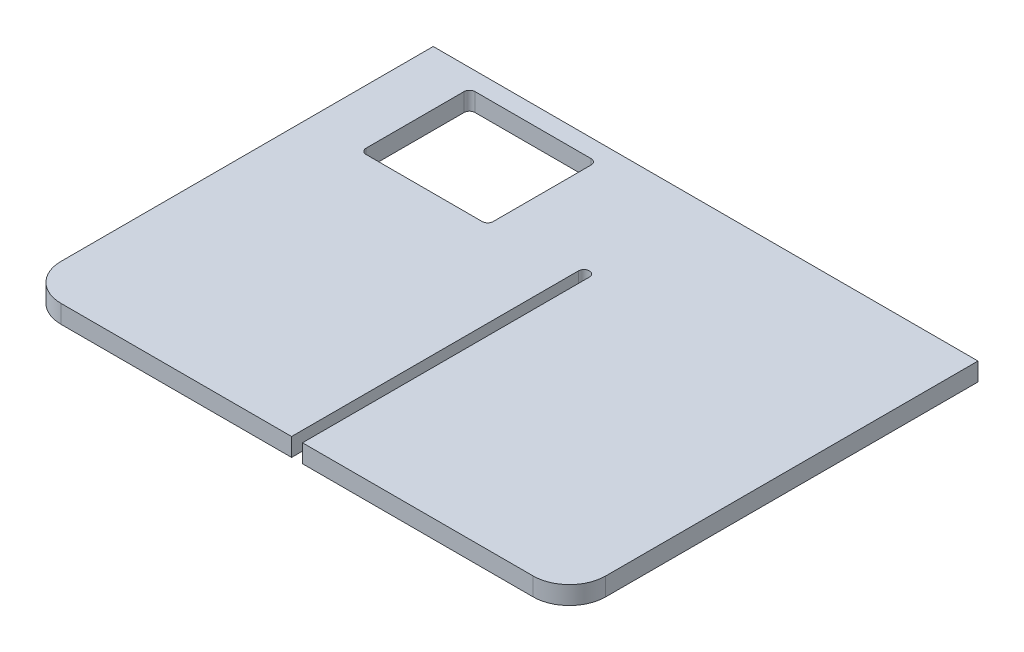
from build123d import *

# Parameters (mm, degrees)
LINEAR_AUSTRAGEN1_DEPTH         = 10
VERRUNDUNG1_R                   = 20
VERRUNDUNG1_OF_SPIEGELN2_R      = 20
SKIZZE3_W                       = 70
SKIZZE3_H                       = 60
SCHNITT_LINEAR_AUSTRAGEN1_DEPTH = 213.367605816
VERRUNDUNG2_R                   = 3
SCHNITT_LINEAR_AUSTRAGEN2_DEPTH = 10


with BuildPart() as part:
    # Skizze1 → Linear austragen1 (new body)
    with BuildSketch(Plane(origin=(0, 0, 0), x_dir=(1, 0, 0), z_dir=(0, 1, 0))):
        Polygon((150, 75), (150, 150), (0, 150), (0, 75), (0, -75), (150, -75), align=None)
    linear_austragen1 = extrude(amount=LINEAR_AUSTRAGEN1_DEPTH)

    # Verrundung1
    verrundung1_edges = [part.edges().sort_by_distance(p)[0] for p in [
        (150, 5, 75),
    ]]
    fillet(verrundung1_edges, radius=VERRUNDUNG1_R)

    # Spiegeln2: Linear austragen1 across plane
    add(linear_austragen1.mirror(Plane(origin=(0, 10, -150), x_dir=(0, 0, 1), z_dir=(1, 0, 0))))

    # Verrundung1 of Spiegeln2
    verrundung1_of_spiegeln2_edges = [part.edges().sort_by_distance(p)[0] for p in [
        (-150, 5, 75),
    ]]
    fillet(verrundung1_of_spiegeln2_edges, radius=VERRUNDUNG1_OF_SPIEGELN2_R)

    # Skizze3 → Schnitt-Linear austragen1 (cut, through all)
    with BuildSketch(Plane(origin=(0, 0, 0), x_dir=(-1, 0, 0), z_dir=(0, 1, 0))):
        with Locations((85, -110)):
            Rectangle(SKIZZE3_W, SKIZZE3_H)
    extrude(amount=SCHNITT_LINEAR_AUSTRAGEN1_DEPTH, mode=Mode.SUBTRACT)

    # Verrundung2
    verrundung2_edges = [part.edges().sort_by_distance(p)[0] for p in [
        (-120, 5, -80),
        (-50, 5, -80),
        (-120, 5, -140),
        (-50, 5, -140),
    ]]
    fillet(verrundung2_edges, radius=VERRUNDUNG2_R)

    # Skizze4 → Schnitt-Linear austragen2 (cut)
    with BuildSketch(Plane.XZ):
        with BuildLine():
            Line((-3, 75), (-3, -83))
            ThreePointArc((-3, -83), (0, -86), (3, -83))
            Line((3, -83), (3, 75))
            Line((3, 75), (-3, 75))
        make_face()
    extrude(amount=-SCHNITT_LINEAR_AUSTRAGEN2_DEPTH, mode=Mode.SUBTRACT)


solid = part.part
